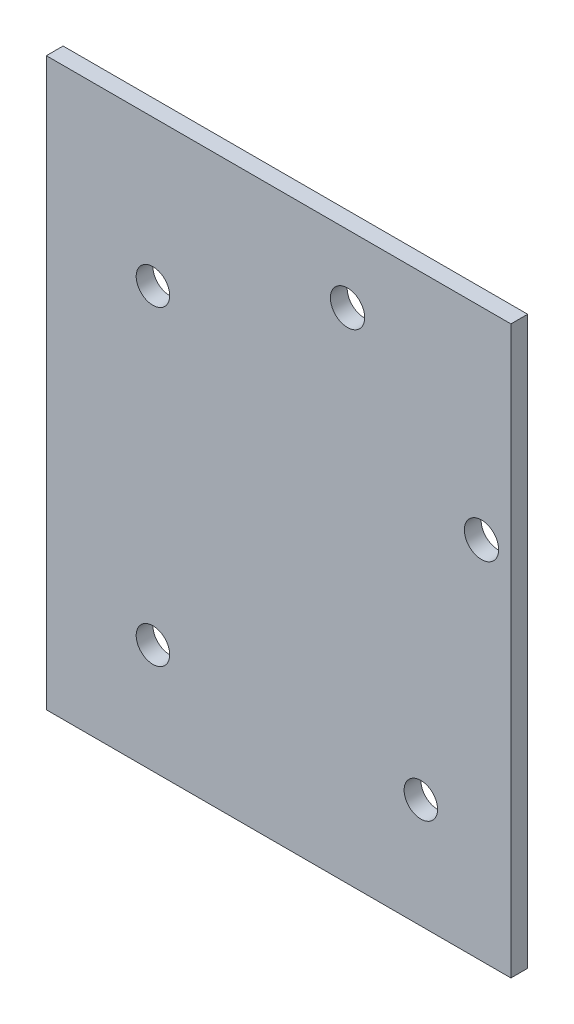
from build123d import *

# Parameters (mm, degrees)
SKETCH1_W           = 88.093703369
SKETCH1_H           = 107.411334798
SKETCH1_R           = 3.175
SKETCH1_R_2         = 3.2512
BOSS_EXTRUDE1_DEPTH = 3.175


with BuildPart() as part:
    # Sketch1 → Boss-Extrude1 (new body)
    with BuildSketch(Plane.XY):
        with Locations((49.234063523, 150.899612868)):
            Rectangle(SKETCH1_W, SKETCH1_H)
        with Locations((25.4, 117.928571429)):
            Circle(SKETCH1_R, mode=Mode.SUBTRACT)
        with Locations((25.4, 176.892857143)):
            Circle(SKETCH1_R, mode=Mode.SUBTRACT)
        with Locations((76.2, 117.928571429)):
            Circle(SKETCH1_R, mode=Mode.SUBTRACT)
        with Locations((87.702054975, 166.37)):
            Circle(SKETCH1_R_2, mode=Mode.SUBTRACT)
        with Locations((62.302054975, 191.77)):
            Circle(SKETCH1_R_2, mode=Mode.SUBTRACT)
    extrude(amount=BOSS_EXTRUDE1_DEPTH)


solid = part.part
